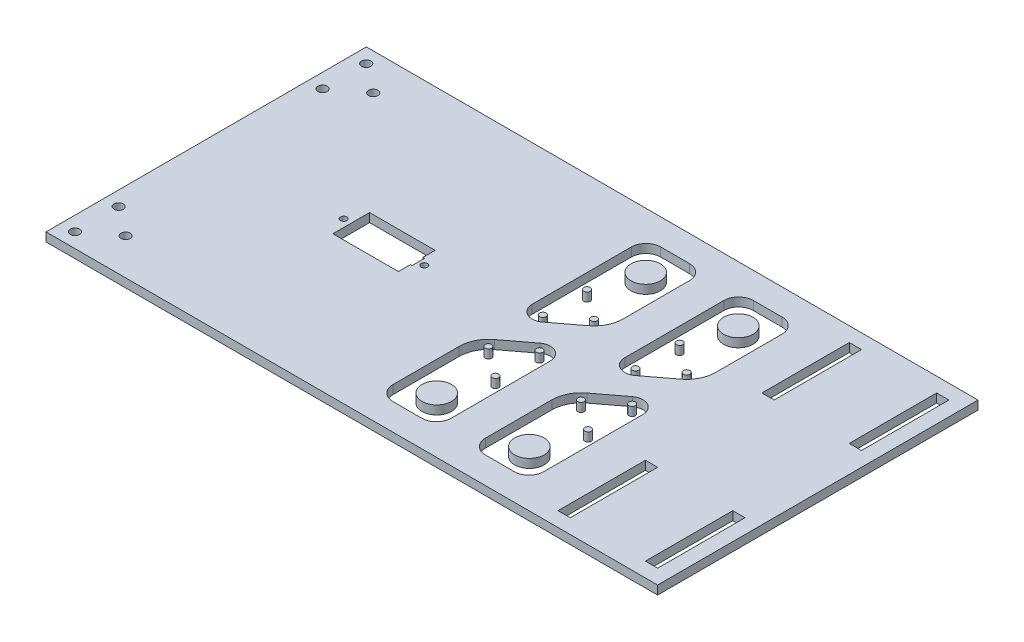
from build123d import *

# Parameters (mm, degrees)
SKETCH2_R           = 1.6
SKETCH2_W           = 4.2
SKETCH2_H           = 30
BOSS_EXTRUDE1_DEPTH = 3
SKETCH3_R           = 1.1
CUT_EXTRUDE1_DEPTH  = 119.570654042
CAVITY2_OUTLINE_R   = 5.05
CAVITY2_OUTLINE_R_2 = 1.111
CAVITY2_DEPTH       = 3


# Read off the part's stored shape, not the designer's step: Cavity2
with BuildPart() as part:
    # Sketch2 → Boss-Extrude1 (new body)
    with BuildSketch(Plane(origin=(0, 0, 0), x_dir=(1, 0, 0), z_dir=(0, 1, 0))):
        Polygon((105, 55), (105, 50), (105, -55), (-105, -55), (-105, 55), (100, 55), align=None)
        with Locations(Location((-90.15, -42.5, 0), (0, 0, 270))):
            Circle(SKETCH2_R, mode=Mode.SUBTRACT)
        with Locations(Location((-100.05, 35, 0), (0, 0, 270))):
            Circle(SKETCH2_R, mode=Mode.SUBTRACT)
        with Locations(Location((-100.05, 50, 0), (0, 0, 270))):
            Circle(SKETCH2_R, mode=Mode.SUBTRACT)
        with Locations(Location((-90.15, 42.5, 0), (0, 0, 270))):
            Circle(SKETCH2_R, mode=Mode.SUBTRACT)
        with Locations(Location((-100.05, -50, 0), (0, 0, 270))):
            Circle(SKETCH2_R, mode=Mode.SUBTRACT)
        with Locations(Location((-100.05, -35, 0), (0, 0, 270))):
            Circle(SKETCH2_R, mode=Mode.SUBTRACT)
        with Locations((97.9, -35)):
            Rectangle(SKETCH2_W, SKETCH2_H, mode=Mode.SUBTRACT)
        Polygon((70, 20), (70, 50), (65.8, 50), (65.8, 20), (67.9, 20), align=None, mode=Mode.SUBTRACT)
        with Locations((97.9, 35)):
            Rectangle(SKETCH2_W, SKETCH2_H, mode=Mode.SUBTRACT)
        with Locations((67.9, -35)):
            Rectangle(SKETCH2_W, SKETCH2_H, mode=Mode.SUBTRACT)
    extrude(amount=BOSS_EXTRUDE1_DEPTH)

    # Sketch3 → Cut-Extrude1 (cut, through all)
    with BuildSketch(Plane(origin=(0, 3, 0), x_dir=(1, 0, 0), z_dir=(0, 1, 0))):
        with Locations(Location((-30.1, 0, 0), (0, 0, 270))):
            Circle(SKETCH3_R)
        with Locations(Location((-57.8, 0, 0), (0, 0, 270))):
            Circle(SKETCH3_R)
        Polygon((-32.7, -2.2), (-32.7, -6.3), (-39, -6.3), (-55.2, -6.3), (-55.2, 6.3), (-39, 6.3), (-32.7, 6.3), (-32.7, 2.2), (-32.151911073, 2.2), (-32.151911073, -2.2), align=None)
    extrude(amount=-CUT_EXTRUDE1_DEPTH, mode=Mode.SUBTRACT)

    # Cavity2 outline → Cavity2 (cut)
    # profile 1 of 4: a face of its own
    with BuildSketch(Plane(origin=(0, 0, 0), x_dir=(1, 0, 0), z_dir=(0, 1, 0))):
        with BuildLine():
            ThreePointArc((19.963273932, -6.823646195), (17.524861401, -2.871998028), (12.899330999, -3.279241706))
            Line((12.899330999, -3.279241706), (3.966311283, -10.046680884))
            ThreePointArc((3.966311283, -10.046680884), (1.020675468, -13.602287819), (-0.034726068, -18.097311581))
            Line((-0.034726068, -18.097311581), (-0.034726068, -40.852769787))
            ThreePointArc((-0.034726068, -40.852769787), (1.444384687, -44.423659032), (5.015273932, -45.902769787))
            Line((5.015273932, -45.902769787), (14.913273932, -45.902769787))
            ThreePointArc((14.913273932, -45.902769787), (18.484163177, -44.423659032), (19.963273932, -40.852769787))
            Line((19.963273932, -40.852769787), (19.963273932, -6.823646195))
        make_face()
        with Locations((9.964273932, -35.802769787)):
            Circle(CAVITY2_OUTLINE_R, mode=Mode.SUBTRACT)
        with Locations((4.964773932, -13.077769787)):
            Circle(CAVITY2_OUTLINE_R_2, mode=Mode.SUBTRACT)
        with Locations((14.963773932, -20.652769787)):
            Circle(CAVITY2_OUTLINE_R_2, mode=Mode.SUBTRACT)
        with Locations((14.963773932, -5.502769787)):
            Circle(CAVITY2_OUTLINE_R_2, mode=Mode.SUBTRACT)
    # profile 2 of 4: a face of its own
    with BuildSketch(Plane(origin=(0, 0, 0), x_dir=(1, 0, 0), z_dir=(0, 1, 0))):
        with BuildLine():
            Line((-0.034726068, 40.988271055), (-0.034726068, 6.959147464))
            ThreePointArc((-0.034726068, 6.959147464), (2.403686463, 3.007499297), (7.029216865, 3.414742974))
            Line((7.029216865, 3.414742974), (15.962236581, 10.182182153))
            ThreePointArc((15.962236581, 10.182182153), (18.907872396, 13.737789087), (19.963273932, 18.232812849))
            Line((19.963273932, 18.232812849), (19.963273932, 40.988271055))
            ThreePointArc((19.963273932, 40.988271055), (18.484163177, 44.5591603), (14.913273932, 46.038271055))
            Line((14.913273932, 46.038271055), (5.015273932, 46.038271055))
            ThreePointArc((5.015273932, 46.038271055), (1.444384687, 44.5591603), (-0.034726068, 40.988271055))
        make_face()
        with Locations((4.964773932, 5.638271055)):
            Circle(CAVITY2_OUTLINE_R_2, mode=Mode.SUBTRACT)
        with Locations((4.964773932, 20.788271055)):
            Circle(CAVITY2_OUTLINE_R_2, mode=Mode.SUBTRACT)
        with Locations((14.963773932, 13.213271055)):
            Circle(CAVITY2_OUTLINE_R_2, mode=Mode.SUBTRACT)
        with Locations((9.964273932, 35.938271055)):
            Circle(CAVITY2_OUTLINE_R, mode=Mode.SUBTRACT)
    # profile 3 of 4: a face of its own
    with BuildSketch(Plane(origin=(0, 0, 0), x_dir=(1, 0, 0), z_dir=(0, 1, 0))):
        with BuildLine():
            Line((36.815273932, -45.902769787), (46.713273932, -45.902769787))
            ThreePointArc((46.713273932, -45.902769787), (50.284163177, -44.423659032), (51.763273932, -40.852769787))
            Line((51.763273932, -40.852769787), (51.763273932, -6.823646195))
            ThreePointArc((51.763273932, -6.823646195), (49.324861401, -2.871998028), (44.699330999, -3.279241706))
            Line((44.699330999, -3.279241706), (35.766311283, -10.046680884))
            ThreePointArc((35.766311283, -10.046680884), (32.820675468, -13.602287819), (31.765273932, -18.097311581))
            Line((31.765273932, -18.097311581), (31.765273932, -40.852769787))
            ThreePointArc((31.765273932, -40.852769787), (33.244384687, -44.423659032), (36.815273932, -45.902769787))
        make_face()
        with Locations((41.764273932, -35.802769787)):
            Circle(CAVITY2_OUTLINE_R, mode=Mode.SUBTRACT)
        with Locations((36.764773932, -13.077769787)):
            Circle(CAVITY2_OUTLINE_R_2, mode=Mode.SUBTRACT)
        with Locations((46.763773932, -20.652769787)):
            Circle(CAVITY2_OUTLINE_R_2, mode=Mode.SUBTRACT)
        with Locations((46.763773932, -5.502769787)):
            Circle(CAVITY2_OUTLINE_R_2, mode=Mode.SUBTRACT)
    # profile 4 of 4: a face of its own
    with BuildSketch(Plane(origin=(0, 0, 0), x_dir=(1, 0, 0), z_dir=(0, 1, 0))):
        with BuildLine():
            ThreePointArc((31.765273932, 6.959147464), (34.203686463, 3.007499297), (38.829216865, 3.414742974))
            Line((38.829216865, 3.414742974), (47.762236581, 10.182182153))
            ThreePointArc((47.762236581, 10.182182153), (50.707872396, 13.737789087), (51.763273932, 18.232812849))
            Line((51.763273932, 18.232812849), (51.763273932, 40.988271055))
            ThreePointArc((51.763273932, 40.988271055), (50.284163177, 44.5591603), (46.713273932, 46.038271055))
            Line((46.713273932, 46.038271055), (36.815273932, 46.038271055))
            ThreePointArc((36.815273932, 46.038271055), (33.244384687, 44.5591603), (31.765273932, 40.988271055))
            Line((31.765273932, 40.988271055), (31.765273932, 6.959147464))
        make_face()
        with Locations((36.764773932, 5.638271055)):
            Circle(CAVITY2_OUTLINE_R_2, mode=Mode.SUBTRACT)
        with Locations((36.764773932, 20.788271055)):
            Circle(CAVITY2_OUTLINE_R_2, mode=Mode.SUBTRACT)
        with Locations((46.763773932, 13.213271055)):
            Circle(CAVITY2_OUTLINE_R_2, mode=Mode.SUBTRACT)
        with Locations((41.764273932, 35.938271055)):
            Circle(CAVITY2_OUTLINE_R, mode=Mode.SUBTRACT)
    extrude(amount=CAVITY2_DEPTH, mode=Mode.SUBTRACT)


solid = part.part
